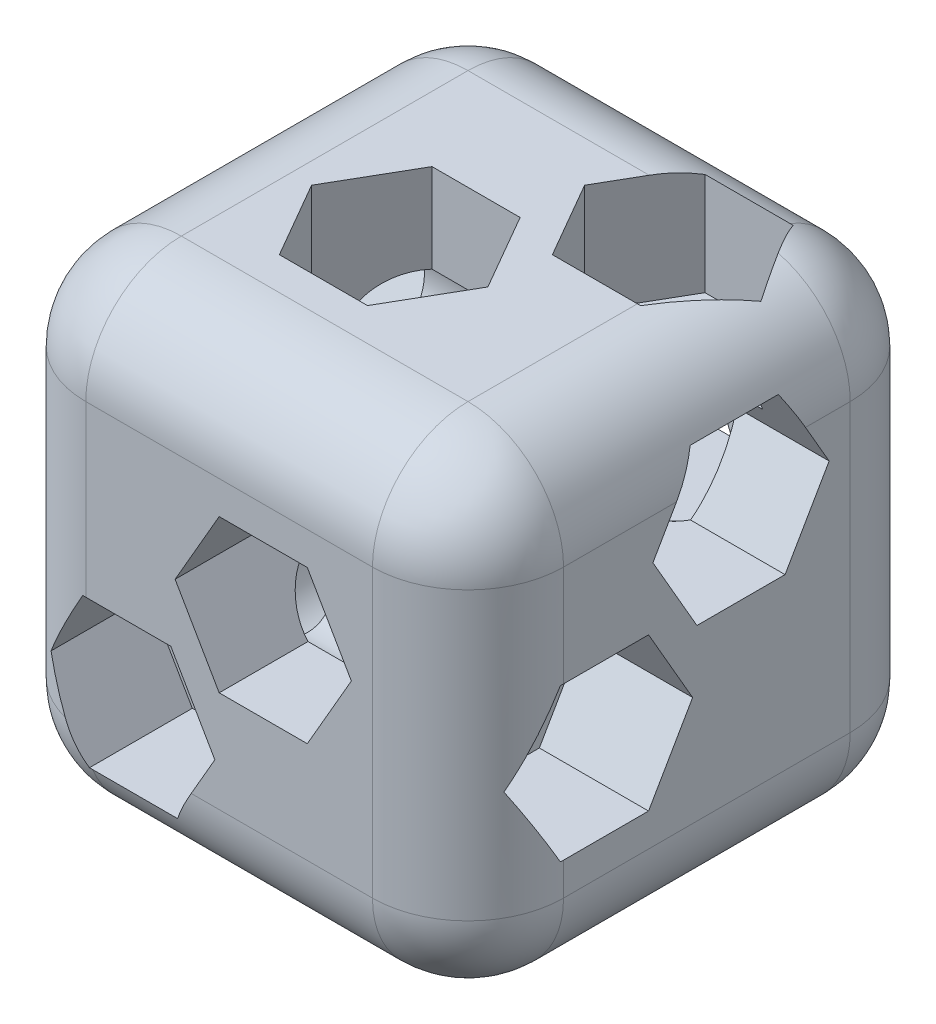
from build123d import *

# Parameters (mm, degrees)
SKETCH1_W           = 22.225
SKETCH1_H           = 22.225
BOSS_EXTRUDE1_DEPTH = 22.225
SKETCH5_R           = 2.25
CUT_EXTRUDE2_DEPTH  = 25.4
SKETCH6_R           = 2.25
CUT_EXTRUDE3_DEPTH  = 25.4
SKETCH7_R           = 2.25
CUT_EXTRUDE4_DEPTH  = 25.4
FILLET2_R           = 4.445
CUT_EXTRUDE5_DEPTH  = 5.25
CUT_EXTRUDE6_DEPTH  = 5.1
CUT_EXTRUDE7_DEPTH  = 5.1
CUT_EXTRUDE8_DEPTH  = 5.08
SKETCH12_R          = 2.25
CUT_EXTRUDE9_DEPTH  = 5.08
CUT_EXTRUDE10_DEPTH = 5.08


with BuildPart() as part:
    # Sketch1 → Boss-Extrude1 (new body)
    with BuildSketch(Plane.XY):
        Rectangle(SKETCH1_W, SKETCH1_H)
    extrude(amount=BOSS_EXTRUDE1_DEPTH)

    # Sketch5 → Cut-Extrude2 (cut)
    with BuildSketch(Plane(origin=(0, 11.1125, 0), x_dir=(1, 0, 0), z_dir=(0, 1, 0))):
        with Locations(Location((-1.5875, -12.7, 0), (0, 0, 180))):
            Circle(SKETCH5_R)
        with Locations(Location((4.7625, -6.35, 0), (0, 0, 180))):
            Circle(SKETCH5_R)
    extrude(amount=-CUT_EXTRUDE2_DEPTH, mode=Mode.SUBTRACT)

    # Sketch6 → Cut-Extrude3 (cut)
    with BuildSketch(Plane(origin=(11.1125, 0, 0), x_dir=(0, 0, -1), z_dir=(1, 0, 0))):
        with Locations((-15.875, -1.5875)):
            Circle(SKETCH6_R)
        with Locations((-9.525, 4.7625)):
            Circle(SKETCH6_R)
    extrude(amount=-CUT_EXTRUDE3_DEPTH, mode=Mode.SUBTRACT)

    # Sketch7 → Cut-Extrude4 (cut)
    with BuildSketch(Plane(origin=(0, 0, 0), x_dir=(-1, 0, 0), z_dir=(0, 0, -1))):
        with Locations((-1.5875, 1.5875)):
            Circle(SKETCH7_R)
        with Locations((4.7625, -4.7625)):
            Circle(SKETCH7_R)
    extrude(amount=-CUT_EXTRUDE4_DEPTH, mode=Mode.SUBTRACT)

    # Fillet2
    # the kernel refuses this fillet: 4.445 mm, written as the material it takes off along each edge
    with BuildSketch(Plane(origin=(6.6675, 6.6675, 17.78), x_dir=(1, 0, 0), z_dir=(0, 0, 1))) as fillet2_piece_1_section:
        Polygon((0, 0), (FILLET2_R, 0), (FILLET2_R, FILLET2_R), (0, FILLET2_R), align=None)
    fillet2_piece_1 = extrude(amount=FILLET2_R, mode=Mode.PRIVATE)
    fillet2_piece_1 = fillet2_piece_1 - Plane(origin=(6.6675, 6.6675, 17.78), x_dir=(-0.7071067811865475, -0.7071067811865476, 0), z_dir=(0, 0, 1)) * Sphere(FILLET2_R, mode=Mode.PRIVATE)
    add(fillet2_piece_1, mode=Mode.SUBTRACT)
    with BuildSketch(Plane(origin=(6.6675, -6.6675, 17.78), x_dir=(0, 0, 1), z_dir=(0, -1, 0))) as fillet2_piece_2_section:
        Polygon((0, 0), (FILLET2_R, 0), (FILLET2_R, -FILLET2_R), (0, -FILLET2_R), align=None)
    fillet2_piece_2 = extrude(amount=FILLET2_R, mode=Mode.PRIVATE)
    fillet2_piece_2 = fillet2_piece_2 - Plane(origin=(6.6675, -6.6675, 17.78), x_dir=(-0.7071067811865475, 0, -0.7071067811865475), z_dir=(0, -1, 0)) * Sphere(FILLET2_R, mode=Mode.PRIVATE)
    add(fillet2_piece_2, mode=Mode.SUBTRACT)
    with BuildSketch(Plane(origin=(-6.6675, 6.6675, 17.78), x_dir=(0, 0, 1), z_dir=(-1, 0, 0))) as fillet2_piece_3_section:
        Polygon((0, 0), (FILLET2_R, 0), (FILLET2_R, FILLET2_R), (0, FILLET2_R), align=None)
    fillet2_piece_3 = extrude(amount=FILLET2_R, mode=Mode.PRIVATE)
    fillet2_piece_3 = fillet2_piece_3 - Plane(origin=(-6.6675, 6.6675, 17.78), x_dir=(0, -0.7071067811865475, -0.7071067811865475), z_dir=(-1, 0, 0)) * Sphere(FILLET2_R, mode=Mode.PRIVATE)
    add(fillet2_piece_3, mode=Mode.SUBTRACT)
    with BuildSketch(Plane(origin=(-6.6675, -6.6675, 17.78), x_dir=(0, 0, 1), z_dir=(-1, 0, 0))) as fillet2_piece_4_section:
        Polygon((0, 0), (FILLET2_R, 0), (FILLET2_R, -FILLET2_R), (0, -FILLET2_R), align=None)
    fillet2_piece_4 = extrude(amount=FILLET2_R, mode=Mode.PRIVATE)
    fillet2_piece_4 = fillet2_piece_4 - Plane(origin=(-6.6675, -6.6675, 17.78), x_dir=(0, 0.7071067811865475, -0.7071067811865475), z_dir=(-1, 0, 0)) * Sphere(FILLET2_R, mode=Mode.PRIVATE)
    add(fillet2_piece_4, mode=Mode.SUBTRACT)
    with BuildSketch(Plane(origin=(-6.6675, 6.6675, 4.445), x_dir=(0, 0, -1), z_dir=(-1, 0, 0))) as fillet2_piece_5_section:
        Polygon((0, 0), (FILLET2_R, 0), (FILLET2_R, -FILLET2_R), (0, -FILLET2_R), align=None)
    fillet2_piece_5 = extrude(amount=FILLET2_R, mode=Mode.PRIVATE)
    fillet2_piece_5 = fillet2_piece_5 - Plane(origin=(-6.6675, 6.6675, 4.445), x_dir=(0, -0.7071067811865475, 0.7071067811865475), z_dir=(-1, 0, 0)) * Sphere(FILLET2_R, mode=Mode.PRIVATE)
    add(fillet2_piece_5, mode=Mode.SUBTRACT)
    with BuildSketch(Plane(origin=(6.6675, 6.6675, 4.445), x_dir=(1, 0, 0), z_dir=(0, 0, -1))) as fillet2_piece_6_section:
        Polygon((0, 0), (FILLET2_R, 0), (FILLET2_R, -FILLET2_R), (0, -FILLET2_R), align=None)
    fillet2_piece_6 = extrude(amount=FILLET2_R, mode=Mode.PRIVATE)
    fillet2_piece_6 = fillet2_piece_6 - Plane(origin=(6.6675, 6.6675, 4.445), x_dir=(-0.7071067811865475, -0.7071067811865476, 0), z_dir=(0, 0, -1)) * Sphere(FILLET2_R, mode=Mode.PRIVATE)
    add(fillet2_piece_6, mode=Mode.SUBTRACT)
    with BuildSketch(Plane(origin=(6.6675, -6.6675, 4.445), x_dir=(0, 0, -1), z_dir=(0, -1, 0))) as fillet2_piece_7_section:
        Polygon((0, 0), (FILLET2_R, 0), (FILLET2_R, FILLET2_R), (0, FILLET2_R), align=None)
    fillet2_piece_7 = extrude(amount=FILLET2_R, mode=Mode.PRIVATE)
    fillet2_piece_7 = fillet2_piece_7 - Plane(origin=(6.6675, -6.6675, 4.445), x_dir=(-0.7071067811865475, 0, 0.7071067811865475), z_dir=(0, -1, 0)) * Sphere(FILLET2_R, mode=Mode.PRIVATE)
    add(fillet2_piece_7, mode=Mode.SUBTRACT)
    with BuildSketch(Plane(origin=(-6.6675, -6.6675, 4.445), x_dir=(-1, 0, 0), z_dir=(0, -1, 0))) as fillet2_piece_8_section:
        Polygon((0, 0), (FILLET2_R, 0), (FILLET2_R, FILLET2_R), (0, FILLET2_R), align=None)
    fillet2_piece_8 = extrude(amount=FILLET2_R, mode=Mode.PRIVATE)
    fillet2_piece_8 = fillet2_piece_8 - Plane(origin=(-6.6675, -6.6675, 4.445), x_dir=(0.7071067811865475, 0, 0.7071067811865475), z_dir=(0, -1, 0)) * Sphere(FILLET2_R, mode=Mode.PRIVATE)
    add(fillet2_piece_8, mode=Mode.SUBTRACT)
    with BuildSketch(Plane(origin=(11.1125, 6.6675, 22.225), x_dir=(-1, 0, 0), z_dir=(0, -1, 0)), Plane(origin=(-6.6675, 11.1125, 0), x_dir=(0, 0, 1), z_dir=(1, 0, 0)), Plane(origin=(6.6675, -11.1125, 0), x_dir=(0, 0, 1), z_dir=(-1, 0, 0)), Plane(origin=(-11.1125, -6.6675, 0), x_dir=(0, 0, 1), z_dir=(0, 1, 0)), Plane(origin=(11.1125, 11.1125, 4.445), x_dir=(-1, 0, 0), z_dir=(0, 0, 1)), Plane(origin=(-11.1125, -11.1125, 4.445), x_dir=(1, 0, 0), z_dir=(0, 0, 1))) as fillet2_piece_9:
        with BuildLine():
            CenterArc((FILLET2_R, FILLET2_R), FILLET2_R, 180, 90)
            Line((0, FILLET2_R), (0, 0))
            Line((0, 0), (FILLET2_R, 0))
        make_face()
    extrude(amount=13.335, mode=Mode.SUBTRACT)
    with BuildSketch(Plane(origin=(-6.6675, 11.1125, 22.225), x_dir=(0, 0, -1), z_dir=(1, 0, 0)), Plane(origin=(-11.1125, -6.6675, 22.225), x_dir=(0, 0, -1), z_dir=(0, 1, 0)), Plane(origin=(11.1125, 6.6675, 0), x_dir=(-1, 0, 0), z_dir=(0, -1, 0)), Plane(origin=(-11.1125, 11.1125, 4.445), x_dir=(1, 0, 0), z_dir=(0, 0, 1)), Plane(origin=(11.1125, -11.1125, 4.445), x_dir=(-1, 0, 0), z_dir=(0, 0, 1)), Plane(origin=(6.6675, -11.1125, 22.225), x_dir=(0, 0, -1), z_dir=(-1, 0, 0))) as fillet2_piece_10:
        with BuildLine():
            CenterArc((FILLET2_R, -FILLET2_R), FILLET2_R, 90, 90)
            Line((0, -FILLET2_R), (0, 0))
            Line((0, 0), (FILLET2_R, 0))
        make_face()
    extrude(amount=13.335, mode=Mode.SUBTRACT)

    # Sketch8 → Cut-Extrude5 (cut)
    with BuildSketch(Plane.ZY.offset(11.1125)):
        Polygon((5.425813089, 4.7625), (7.475406544, 1.2125), (11.574593456, 1.2125), (13.624186911, 4.7625), (11.574593456, 8.3125), (7.475406544, 8.3125), align=None)
        Polygon((13.825406544, 1.9625), (11.775813089, -1.5875), (13.825406544, -5.1375), (17.924593456, -5.1375), (19.974186911, -1.5875), (17.924593456, 1.9625), align=None)
    extrude(amount=-CUT_EXTRUDE5_DEPTH, mode=Mode.SUBTRACT)

    # Sketch9 → Cut-Extrude6 (cut)
    with BuildSketch(Plane.XZ.offset(11.1125)):
        Polygon((-3.637093456, 16.25), (-5.686686911, 12.7), (-3.637093456, 9.15), (0.462093456, 9.15), (2.511686911, 12.7), (0.462093456, 16.25), align=None)
        Polygon((2.712906544, 9.9), (0.663313089, 6.35), (2.712906544, 2.8), (6.812093456, 2.8), (8.861686911, 6.35), (6.812093456, 9.9), align=None)
    extrude(amount=-CUT_EXTRUDE6_DEPTH, mode=Mode.SUBTRACT)

    # Sketch10 → Cut-Extrude7 (cut)
    with BuildSketch(Plane(origin=(0, 0, 22.225), x_dir=(-1, 0, 0), z_dir=(0, 0, -1))):
        Polygon((-3.637093456, 5.1375), (-5.686686911, 1.5875), (-3.637093456, -1.9625), (0.462093456, -1.9625), (2.511686911, 1.5875), (0.462093456, 5.1375), align=None)
        Polygon((2.712906544, -1.2125), (0.663313089, -4.7625), (2.712906544, -8.3125), (6.812093456, -8.3125), (8.861686911, -4.7625), (6.812093456, -1.2125), align=None)
    extrude(amount=CUT_EXTRUDE7_DEPTH, mode=Mode.SUBTRACT)

    # Sketch11 → Cut-Extrude8 (cut)
    with BuildSketch(Plane(origin=(11.1125, 0, 0), x_dir=(0, 0, -1), z_dir=(1, 0, 0))):
        with BuildLine():
            Line((-13.825406544, 1.9625), (-17.78, 1.9625))
            Line((-17.78, 1.9625), (-17.78, -0.390221837))
            ThreePointArc((-17.78, -0.390221837), (-13.625, -1.5875), (-17.78, -2.784778163))
            Line((-17.78, -2.784778163), (-17.78, -5.1375))
            Line((-17.78, -5.1375), (-13.825406544, -5.1375))
            Line((-13.825406544, -5.1375), (-11.775813089, -1.5875))
            Line((-11.775813089, -1.5875), (-13.825406544, 1.9625))
        make_face()
        with BuildLine():
            Line((-5.425813089, 4.7625), (-6.525665352, 6.6675))
            Line((-6.525665352, 6.6675), (-8.327721837, 6.6675))
            ThreePointArc((-8.327721837, 6.6675), (-9.525, 2.5125), (-10.722278163, 6.6675))
            Line((-10.722278163, 6.6675), (-12.524334648, 6.6675))
            Line((-12.524334648, 6.6675), (-13.624186911, 4.7625))
            Line((-13.624186911, 4.7625), (-11.574593456, 1.2125))
            Line((-11.574593456, 1.2125), (-7.475406544, 1.2125))
            Line((-7.475406544, 1.2125), (-5.425813089, 4.7625))
        make_face()
        with BuildLine():
            Line((-6.525665352, 6.6675), (-7.475406544, 8.3125))
            Line((-7.475406544, 8.3125), (-11.574593456, 8.3125))
            Line((-11.574593456, 8.3125), (-12.524334648, 6.6675))
            Line((-12.524334648, 6.6675), (-10.722278163, 6.6675))
            ThreePointArc((-10.722278163, 6.6675), (-9.525, 2.5125), (-8.327721837, 6.6675))
            Line((-8.327721837, 6.6675), (-6.525665352, 6.6675))
        make_face()
        with BuildLine():
            Line((-17.78, -0.390221837), (-17.78, 1.9625))
            Line((-17.78, 1.9625), (-17.924593456, 1.9625))
            Line((-17.924593456, 1.9625), (-19.974186911, -1.5875))
            Line((-19.974186911, -1.5875), (-17.924593456, -5.1375))
            Line((-17.924593456, -5.1375), (-17.78, -5.1375))
            Line((-17.78, -5.1375), (-17.78, -2.784778163))
            ThreePointArc((-17.78, -2.784778163), (-13.625, -1.5875), (-17.78, -0.390221837))
        make_face()
    extrude(amount=-CUT_EXTRUDE8_DEPTH, mode=Mode.SUBTRACT)

    # Sketch12 → Cut-Extrude9 (cut)
    # profile 1 of 3: a face of its own
    with BuildSketch(Plane(origin=(0, 0, 0), x_dir=(-1, 0, 0), z_dir=(0, 0, -1))):
        Polygon((-3.637093456, -1.9625), (0.462093456, -1.9625), (2.511686911, 1.5875), (0.462093456, 5.1375), (-3.637093456, 5.1375), (-5.686686911, 1.5875), align=None)
        with Locations((-1.5875, 1.5875)):
            Circle(SKETCH12_R, mode=Mode.SUBTRACT)
    # profile 2 of 3: a face of its own
    with BuildSketch(Plane(origin=(0, 0, 0), x_dir=(-1, 0, 0), z_dir=(0, 0, -1))):
        with BuildLine():
            Line((0.663313089, -4.7625), (1.763165352, -6.6675))
            Line((1.763165352, -6.6675), (3.565221837, -6.6675))
            ThreePointArc((3.565221837, -6.6675), (3.171509742, -3.171509742), (6.6675, -3.565221837))
            Line((6.6675, -3.565221837), (6.6675, -1.2125))
            Line((6.6675, -1.2125), (2.712906544, -1.2125))
            Line((2.712906544, -1.2125), (0.663313089, -4.7625))
        make_face()
    # profile 3 of 3: a face of its own
    with BuildSketch(Plane(origin=(0, 0, 0), x_dir=(-1, 0, 0), z_dir=(0, 0, -1))):
        with BuildLine():
            Line((6.6675, -8.3125), (6.812093456, -8.3125))
            Line((6.812093456, -8.3125), (7.761834648, -6.6675))
            Line((7.761834648, -6.6675), (8.861686911, -4.7625))
            Line((8.861686911, -4.7625), (6.812093456, -1.2125))
            Line((6.812093456, -1.2125), (6.6675, -1.2125))
            Line((6.6675, -1.2125), (6.6675, -3.565221837))
            ThreePointArc((6.6675, -3.565221837), (3.171509742, -3.171509742), (3.565221837, -6.6675))
            Line((3.565221837, -6.6675), (1.763165352, -6.6675))
            Line((1.763165352, -6.6675), (2.712906544, -8.3125))
            Line((2.712906544, -8.3125), (6.6675, -8.3125))
        make_face()
    extrude(amount=-CUT_EXTRUDE9_DEPTH, mode=Mode.SUBTRACT)

    # Sketch14 → Cut-Extrude10 (cut)
    with BuildSketch(Plane(origin=(0, 11.1125, 0), x_dir=(1, 0, 0), z_dir=(0, 1, 0))):
        with BuildLine():
            Line((-2.891671307, -14.533476807), (-2.891671307, -16.25))
            Line((-2.891671307, -16.25), (0.462093456, -16.25))
            Line((0.462093456, -16.25), (2.511686911, -12.7))
            Line((2.511686911, -12.7), (0.462093456, -9.15))
            Line((0.462093456, -9.15), (-2.891671307, -9.15))
            Line((-2.891671307, -9.15), (-2.891671307, -10.866523193))
            ThreePointArc((-2.891671307, -10.866523193), (-0.555968478, -10.700389358), (0.6625, -12.7))
            ThreePointArc((0.6625, -12.7), (-0.555968478, -14.699610642), (-2.891671307, -14.533476807))
        make_face()
        with BuildLine():
            Line((-3.637093456, -16.25), (-2.891671307, -16.25))
            Line((-2.891671307, -16.25), (-2.891671307, -14.533476807))
            ThreePointArc((-2.891671307, -14.533476807), (-3.8375, -12.7), (-2.891671307, -10.866523193))
            Line((-2.891671307, -10.866523193), (-2.891671307, -9.15))
            Line((-2.891671307, -9.15), (-3.637093456, -9.15))
            Line((-3.637093456, -9.15), (-5.686686911, -12.7))
            Line((-5.686686911, -12.7), (-3.637093456, -16.25))
        make_face()
        with BuildLine():
            Line((2.712906544, -9.9), (6.6675, -9.9))
            Line((6.6675, -9.9), (6.6675, -7.547278163))
            ThreePointArc((6.6675, -7.547278163), (3.171509742, -7.940990258), (3.565221837, -4.445))
            Line((3.565221837, -4.445), (1.763165352, -4.445))
            Line((1.763165352, -4.445), (0.663313089, -6.35))
            Line((0.663313089, -6.35), (2.712906544, -9.9))
        make_face()
        with BuildLine():
            Line((6.6675, -9.9), (6.812093456, -9.9))
            Line((6.812093456, -9.9), (8.861686911, -6.35))
            Line((8.861686911, -6.35), (6.812093456, -2.8))
            Line((6.812093456, -2.8), (2.712906544, -2.8))
            Line((2.712906544, -2.8), (1.763165352, -4.445))
            Line((1.763165352, -4.445), (3.565221837, -4.445))
            ThreePointArc((3.565221837, -4.445), (3.171509742, -7.940990258), (6.6675, -7.547278163))
            Line((6.6675, -7.547278163), (6.6675, -9.9))
        make_face()
    extrude(amount=-CUT_EXTRUDE10_DEPTH, mode=Mode.SUBTRACT)


solid = part.part
